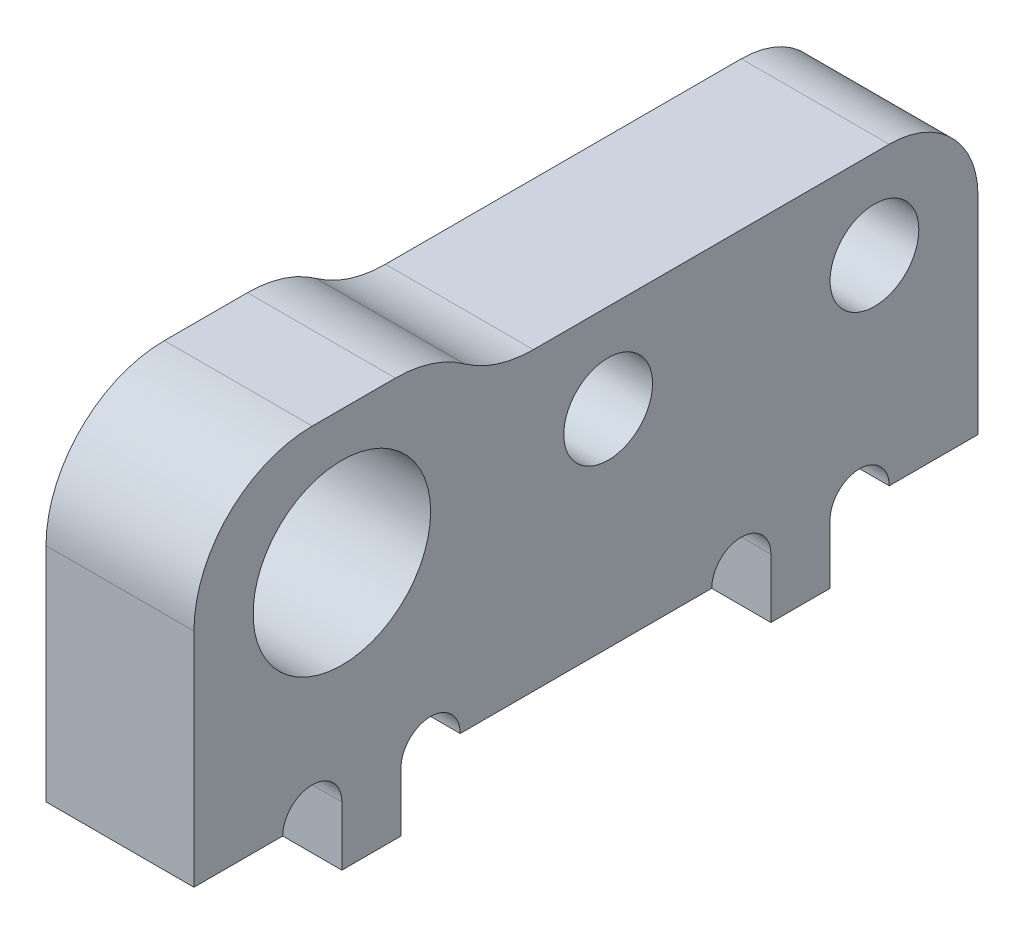
from build123d import *

# Parameters (mm, degrees)
BASE_W                    = 5
BASE_H                    = 26.5
BODY_DEPTH                = 11.5
F_6_0MM_MOTOR_D           = 6
F_3_0MM_BEARINGS_D        = 3
WEIGHT_SAVER_REACH        = 31.317
SKETCH9_W                 = 18.15
SKETCH9_H                 = 1.5
FILLET2_R                 = 3
FILLET1_R                 = 4
FILLET4_R                 = 4
FILLET5_R                 = 4
SKETCH10_W                = 5
SKETCH10_H                = 2
MOUNTING_DEPTH            = 2
MOUNTIN_UNDERCUT_REACH    = 31.317
F_4_0MM_DOWEL_HOLE2_D     = 4.5
F_4_0MM_DOWEL_HOLE2_DEPTH = 1.5


with BuildPart() as part:
    # base → body (new body)
    with BuildSketch(Plane(origin=(0, 0, 0), x_dir=(1, 0, 0), z_dir=(0, 1, 0))):
        with Locations((2.5, 13.25)):
            Rectangle(BASE_W, BASE_H)
    extrude(amount=BODY_DEPTH)

    # Ø6.0mm motor (through all)
    with Locations(Plane(origin=(5, 0, 0), x_dir=(0, 0, -1), z_dir=(1, 0, 0))):
        with Locations((5, 7)):
            Hole(F_6_0MM_MOTOR_D / 2)

    # Ø3.0mm bearings (through all)
    with Locations(Plane(origin=(5, 0, 0), x_dir=(0, 0, -1), z_dir=(1, 0, 0))):
        with Locations((14, 7), (23, 7)):
            Hole(F_3_0MM_BEARINGS_D / 2)

    # Sketch9 → weight_saver (cut, up to next)
    with BuildSketch(Plane(origin=(5, 0, 0), x_dir=(0, 0, -1), z_dir=(1, 0, 0)), mode=Mode.PRIVATE) as weight_saver_sk1:
        with Locations((17.425, 10.75)):
            Rectangle(SKETCH9_W, SKETCH9_H)
    weight_saver_tool1 = extrude(weight_saver_sk1.sketch, amount=-WEIGHT_SAVER_REACH, mode=Mode.PRIVATE) & part.part
    add(weight_saver_tool1.solids().sort_by_distance((5, 10.75, -17.425))[0], mode=Mode.SUBTRACT)

    # Fillet2
    fillet2_edges = [part.edges().sort_by_distance(p)[0] for p in [
        (2.5, 10, -26.5),
    ]]
    fillet(fillet2_edges, radius=FILLET2_R)

    # Fillet1
    fillet1_edges = [part.edges().sort_by_distance(p)[0] for p in [
        (2.5, 11.5, 0),
    ]]
    fillet(fillet1_edges, radius=FILLET1_R)

    # Fillet4
    # the kernel refuses this fillet: 4 mm, written as the material it adds along each edge
    with BuildSketch(Plane(origin=(5, 10, -8.35), x_dir=(0, 1, 0), z_dir=(-1, 0, 0))) as fillet4_piece_1:
        with BuildLine():
            CenterArc((4, 3.122498999), FILLET4_R, 180, 51.317812547)
            Line((0, 3.122498999), (-0.08, 3.122498999))
            Line((-0.08, 3.122498999), (-0.08, 0))
            Line((-0.08, 0), (0, -0.08))
            ThreePointArc((0, -0.08), (0.75, -0.08), (1.45, -0.06244998))
            Line((1.45, -0.06244998), (1.5, 0))
        make_face()
    extrude(amount=5)

    # Fillet5
    fillet5_edges = [part.edges().sort_by_distance(p)[0] for p in [
        (2.5, 11.5, -8.35),
    ]]
    fillet(fillet5_edges, radius=FILLET5_R)

    # Sketch10 → mounting (add)
    with BuildSketch(Plane.XZ):
        with Locations((2.5, -6)):
            Rectangle(SKETCH10_W, SKETCH10_H)
        with Locations((2.5, -20.5)):
            Rectangle(SKETCH10_W, SKETCH10_H)
    extrude(amount=MOUNTING_DEPTH)

    # mounting_undercut → mountin_undercut (cut, up to next)
    with BuildSketch(Plane(origin=(5, 0, 0), x_dir=(0, 0, -1), z_dir=(1, 0, 0)), mode=Mode.PRIVATE) as mountin_undercut_sk1:
        with BuildLine():
            Line((3, 0), (5, 0))
            ThreePointArc((5, 0), (4, 1), (3, 0))
        make_face()
    mountin_undercut_tool1 = extrude(mountin_undercut_sk1.sketch, amount=-MOUNTIN_UNDERCUT_REACH, mode=Mode.PRIVATE) & part.part
    # mounting_undercut → mountin_undercut (cut, up to next)
    with BuildSketch(Plane(origin=(5, 0, 0), x_dir=(0, 0, -1), z_dir=(1, 0, 0)), mode=Mode.PRIVATE) as mountin_undercut_sk2:
        with BuildLine():
            Line((7, 0), (9, 0))
            ThreePointArc((9, 0), (8, 1), (7, 0))
        make_face()
    mountin_undercut_tool2 = extrude(mountin_undercut_sk2.sketch, amount=-MOUNTIN_UNDERCUT_REACH, mode=Mode.PRIVATE) & part.part
    # mounting_undercut → mountin_undercut (cut, up to next)
    with BuildSketch(Plane(origin=(5, 0, 0), x_dir=(0, 0, -1), z_dir=(1, 0, 0)), mode=Mode.PRIVATE) as mountin_undercut_sk3:
        with BuildLine():
            Line((17.5, 0), (19.5, 0))
            ThreePointArc((19.5, 0), (18.5, 1), (17.5, 0))
        make_face()
    mountin_undercut_tool3 = extrude(mountin_undercut_sk3.sketch, amount=-MOUNTIN_UNDERCUT_REACH, mode=Mode.PRIVATE) & part.part
    # mounting_undercut → mountin_undercut (cut, up to next)
    with BuildSketch(Plane(origin=(5, 0, 0), x_dir=(0, 0, -1), z_dir=(1, 0, 0)), mode=Mode.PRIVATE) as mountin_undercut_sk4:
        with BuildLine():
            Line((21.5, 0), (23.5, 0))
            ThreePointArc((23.5, 0), (22.5, 1), (21.5, 0))
        make_face()
    mountin_undercut_tool4 = extrude(mountin_undercut_sk4.sketch, amount=-MOUNTIN_UNDERCUT_REACH, mode=Mode.PRIVATE) & part.part
    add(mountin_undercut_tool1.solids().sort_by_distance((5, 0.424413, -4))[0], mode=Mode.SUBTRACT)
    add(mountin_undercut_tool2.solids().sort_by_distance((5, 0.424413, -8))[0], mode=Mode.SUBTRACT)
    add(mountin_undercut_tool3.solids().sort_by_distance((5, 0.424413, -18.5))[0], mode=Mode.SUBTRACT)
    add(mountin_undercut_tool4.solids().sort_by_distance((5, 0.424413, -22.5))[0], mode=Mode.SUBTRACT)

    # Ø4.0mm Dowel Hole2
    with Locations(Plane.ZY):
        with Locations((-23, 7)):
            Hole(F_4_0MM_DOWEL_HOLE2_D / 2, depth=F_4_0MM_DOWEL_HOLE2_DEPTH)


solid = part.part
